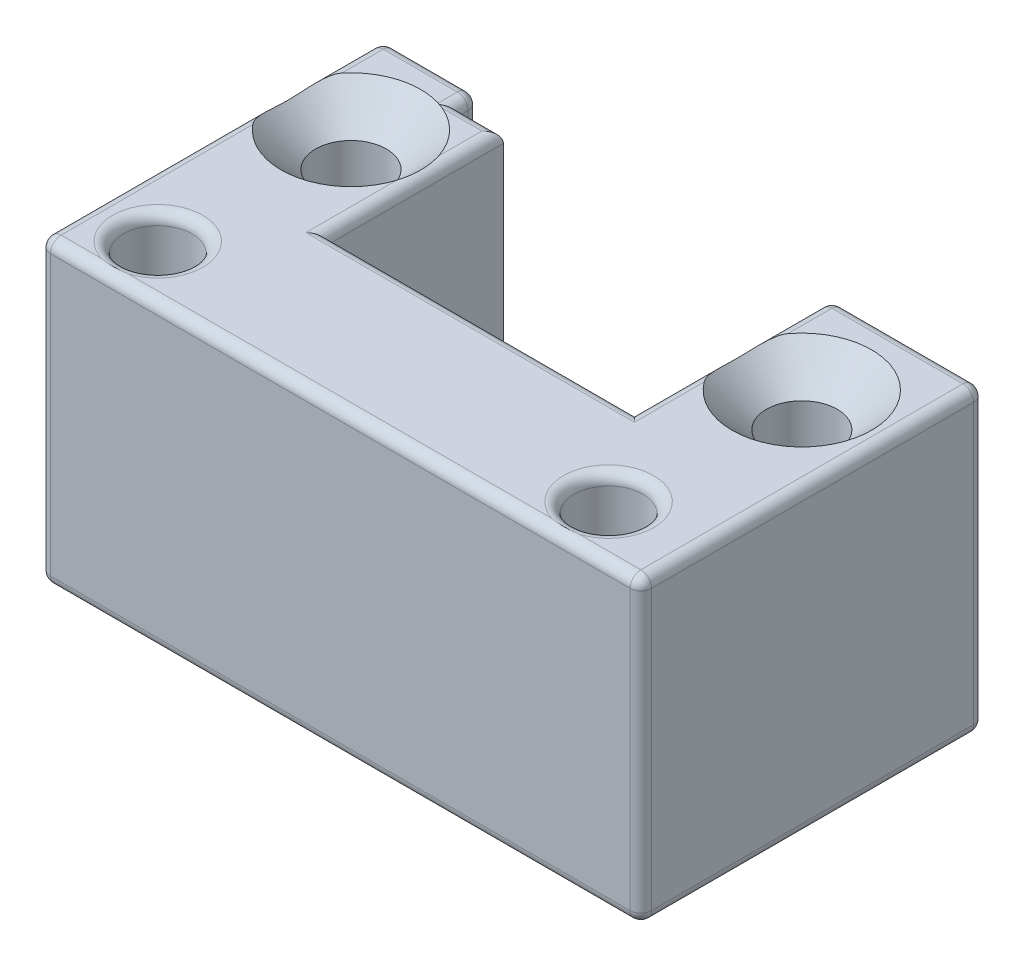
from build123d import *

# Parameters (mm, degrees)
SKETCH1_W                                       = 28
SKETCH1_H                                       = 16
SKETCH1_R                                       = 0.85
SKETCH1_R_2                                     = 1.6
BOSS_EXTRUDE1_DEPTH                             = 4
SKETCH2_R                                       = 1.6
BOSS_EXTRUDE2_DEPTH                             = 10
FILLET1_R                                       = 0.5
CSK_FOR_M5_FLAT_HEAD_MACHINE_SCREW1_D           = 3.3
CSK_FOR_M5_FLAT_HEAD_MACHINE_SCREW1_CSINK_D     = 6.5
CSK_FOR_M5_FLAT_HEAD_MACHINE_SCREW1_CSINK_ANGLE = 90


with BuildPart() as part:
    # Sketch1 → Boss-Extrude1 (new body)
    with BuildSketch(Plane(origin=(0, 0, 0), x_dir=(1, 0, 0), z_dir=(0, 1, 0))):
        with Locations((0, -2)):
            Rectangle(SKETCH1_W, SKETCH1_H)
        with Locations(Location((3.25, 0, 0), (0, 0, 270))):
            Circle(SKETCH1_R, mode=Mode.SUBTRACT)
        with Locations(Location((-3.25, 0, 0), (0, 0, 270))):
            Circle(SKETCH1_R, mode=Mode.SUBTRACT)
        with Locations(Location((-11, -7.5, 0), (0, 0, 270))):
            Circle(SKETCH1_R_2, mode=Mode.SUBTRACT)
        with Locations(Location((10, -7.5, 0), (0, 0, 270))):
            Circle(SKETCH1_R_2, mode=Mode.SUBTRACT)
        with Locations(Location((-11, 1.5, 0), (0, 0, 270))):
            Circle(SKETCH1_R_2, mode=Mode.SUBTRACT)
        with Locations(Location((10, 1.5, 0), (0, 0, 270))):
            Circle(SKETCH1_R_2, mode=Mode.SUBTRACT)
    extrude(amount=BOSS_EXTRUDE1_DEPTH)

    # Sketch2 → Boss-Extrude2 (add)
    with BuildSketch(Plane(origin=(0, 4, 0), x_dir=(1, 0, 0), z_dir=(0, 1, 0))):
        Polygon((-9.546214808, 6), (-9.546214808, 5), (-7.4, 5), (-7.4, -3.2), (6.9, -3.2), (6.9, 6), (14, 6), (14, -10), (-14, -10), (-14, 6), align=None)
        with Locations(Location((-11, -7.5, 0), (0, 0, 270))):
            Circle(SKETCH2_R, mode=Mode.SUBTRACT)
        with Locations(Location((10, -7.5, 0), (0, 0, 270))):
            Circle(SKETCH2_R, mode=Mode.SUBTRACT)
        with Locations(Location((10, 1.5, 0), (0, 0, 270))):
            Circle(SKETCH2_R, mode=Mode.SUBTRACT)
        with Locations(Location((-11, 1.5, 0), (0, 0, 270))):
            Circle(SKETCH2_R, mode=Mode.SUBTRACT)
    extrude(amount=BOSS_EXTRUDE2_DEPTH)

    # Fillet1
    # the kernel refuses this fillet: 0.5 mm, written as the material it takes off along each edge
    with BuildSketch(Plane(origin=(-13.5, 13.5, -5.5), x_dir=(-1, 0, 0), z_dir=(0, 1, 0))) as fillet1_piece_1_section:
        Polygon((0, 0), (FILLET1_R, 0), (FILLET1_R, -FILLET1_R), (0, -FILLET1_R), align=None)
    fillet1_piece_1 = extrude(amount=FILLET1_R, mode=Mode.PRIVATE)
    fillet1_piece_1 = fillet1_piece_1 - Plane(origin=(-13.5, 13.5, -5.5), x_dir=(0.7071067811865477, 0, 0.7071067811865475), z_dir=(0, 1, 0)) * Sphere(FILLET1_R, mode=Mode.PRIVATE)
    add(fillet1_piece_1, mode=Mode.SUBTRACT)
    with BuildSketch(Plane(origin=(-10.046214808, 13.5, -5.5), x_dir=(1, 0, 0), z_dir=(0, 1, 0))) as fillet1_piece_2_section:
        Polygon((0, 0), (FILLET1_R, 0), (FILLET1_R, FILLET1_R), (0, FILLET1_R), align=None)
    fillet1_piece_2 = extrude(amount=FILLET1_R, mode=Mode.PRIVATE)
    fillet1_piece_2 = fillet1_piece_2 - Plane(origin=(-10.046214808, 13.5, -5.5), x_dir=(-0.7071067811865475, 0, 0.7071067811865476), z_dir=(0, 1, 0)) * Sphere(FILLET1_R, mode=Mode.PRIVATE)
    add(fillet1_piece_2, mode=Mode.SUBTRACT)
    with BuildSketch(Plane(origin=(-13.5, 13.5, 9.5), x_dir=(-1, 0, 0), z_dir=(0, 1, 0))) as fillet1_piece_3_section:
        Polygon((0, 0), (FILLET1_R, 0), (FILLET1_R, FILLET1_R), (0, FILLET1_R), align=None)
    fillet1_piece_3 = extrude(amount=FILLET1_R, mode=Mode.PRIVATE)
    fillet1_piece_3 = fillet1_piece_3 - Plane(origin=(-13.5, 13.5, 9.5), x_dir=(0.7071067811865475, 0, -0.7071067811865476), z_dir=(0, 1, 0)) * Sphere(FILLET1_R, mode=Mode.PRIVATE)
    add(fillet1_piece_3, mode=Mode.SUBTRACT)
    with BuildSketch(Plane(origin=(13.5, 13.5, 9.5), x_dir=(0, 1, 0), z_dir=(0, 0, 1))) as fillet1_piece_4_section:
        Polygon((0, 0), (FILLET1_R, 0), (FILLET1_R, -FILLET1_R), (0, -FILLET1_R), align=None)
    fillet1_piece_4 = extrude(amount=FILLET1_R, mode=Mode.PRIVATE)
    fillet1_piece_4 = fillet1_piece_4 - Plane(origin=(13.5, 13.5, 9.5), x_dir=(-0.7071067811865475, -0.7071067811865475, 0), z_dir=(0, 0, 1)) * Sphere(FILLET1_R, mode=Mode.PRIVATE)
    add(fillet1_piece_4, mode=Mode.SUBTRACT)
    with BuildSketch(Plane(origin=(13.5, 13.5, -5.5), x_dir=(0, 0, -1), z_dir=(0, 1, 0))) as fillet1_piece_5_section:
        Polygon((0, 0), (FILLET1_R, 0), (FILLET1_R, -FILLET1_R), (0, -FILLET1_R), align=None)
    fillet1_piece_5 = extrude(amount=FILLET1_R, mode=Mode.PRIVATE)
    fillet1_piece_5 = fillet1_piece_5 - Plane(origin=(13.5, 13.5, -5.5), x_dir=(-0.7071067811865474, 0, 0.7071067811865477), z_dir=(0, 1, 0)) * Sphere(FILLET1_R, mode=Mode.PRIVATE)
    add(fillet1_piece_5, mode=Mode.SUBTRACT)
    with BuildSketch(Plane(origin=(7.4, 13.5, -5.5), x_dir=(-1, 0, 0), z_dir=(0, 1, 0))) as fillet1_piece_6_section:
        Polygon((0, 0), (FILLET1_R, 0), (FILLET1_R, -FILLET1_R), (0, -FILLET1_R), align=None)
    fillet1_piece_6 = extrude(amount=FILLET1_R, mode=Mode.PRIVATE)
    fillet1_piece_6 = fillet1_piece_6 - Plane(origin=(7.4, 13.5, -5.5), x_dir=(0.7071067811865477, 0, 0.7071067811865475), z_dir=(0, 1, 0)) * Sphere(FILLET1_R, mode=Mode.PRIVATE)
    add(fillet1_piece_6, mode=Mode.SUBTRACT)
    with BuildSketch(Plane(origin=(-13.5, 0.5, 9.5), x_dir=(0, -1, 0), z_dir=(0, 0, 1))) as fillet1_piece_7_section:
        Polygon((0, 0), (FILLET1_R, 0), (FILLET1_R, -FILLET1_R), (0, -FILLET1_R), align=None)
    fillet1_piece_7 = extrude(amount=FILLET1_R, mode=Mode.PRIVATE)
    fillet1_piece_7 = fillet1_piece_7 - Plane(origin=(-13.5, 0.5, 9.5), x_dir=(0.7071067811865475, 0.7071067811865475, 0), z_dir=(0, 0, 1)) * Sphere(FILLET1_R, mode=Mode.PRIVATE)
    add(fillet1_piece_7, mode=Mode.SUBTRACT)
    with BuildSketch(Plane(origin=(13.5, 0.5, 9.5), x_dir=(0, -1, 0), z_dir=(0, 0, 1))) as fillet1_piece_8_section:
        Polygon((0, 0), (FILLET1_R, 0), (FILLET1_R, FILLET1_R), (0, FILLET1_R), align=None)
    fillet1_piece_8 = extrude(amount=FILLET1_R, mode=Mode.PRIVATE)
    fillet1_piece_8 = fillet1_piece_8 - Plane(origin=(13.5, 0.5, 9.5), x_dir=(-0.7071067811865475, 0.7071067811865475, 0), z_dir=(0, 0, 1)) * Sphere(FILLET1_R, mode=Mode.PRIVATE)
    add(fillet1_piece_8, mode=Mode.SUBTRACT)
    with BuildSketch(Plane(origin=(-13.5, 0.5, -5.5), x_dir=(-1, 0, 0), z_dir=(0, -1, 0))) as fillet1_piece_9_section:
        Polygon((0, 0), (FILLET1_R, 0), (FILLET1_R, FILLET1_R), (0, FILLET1_R), align=None)
    fillet1_piece_9 = extrude(amount=FILLET1_R, mode=Mode.PRIVATE)
    fillet1_piece_9 = fillet1_piece_9 - Plane(origin=(-13.5, 0.5, -5.5), x_dir=(0.7071067811865477, 0, 0.7071067811865475), z_dir=(0, -1, 0)) * Sphere(FILLET1_R, mode=Mode.PRIVATE)
    add(fillet1_piece_9, mode=Mode.SUBTRACT)
    with BuildSketch(Plane(origin=(13.5, 0.5, -5.5), x_dir=(0, 0, -1), z_dir=(0, -1, 0))) as fillet1_piece_10_section:
        Polygon((0, 0), (FILLET1_R, 0), (FILLET1_R, FILLET1_R), (0, FILLET1_R), align=None)
    fillet1_piece_10 = extrude(amount=FILLET1_R, mode=Mode.PRIVATE)
    fillet1_piece_10 = fillet1_piece_10 - Plane(origin=(13.5, 0.5, -5.5), x_dir=(-0.7071067811865474, 0, 0.7071067811865477), z_dir=(0, -1, 0)) * Sphere(FILLET1_R, mode=Mode.PRIVATE)
    add(fillet1_piece_10, mode=Mode.SUBTRACT)
    with BuildSketch(Plane(origin=(3.25, 0, 0), x_dir=(0, 0, 1), z_dir=(-1, 0, 0))) as fillet1_piece_11:
        with BuildLine():
            CenterArc((0.85 + FILLET1_R, FILLET1_R), FILLET1_R, 180, 90)
            Line((0.85, FILLET1_R), (0.85, 0))
            Line((0.85, 0), (0.85 + FILLET1_R, 0))
        make_face()
    revolve(axis=Axis((3.25, 0, 0), (0, 1, 0)), mode=Mode.SUBTRACT)
    with BuildSketch(Plane(origin=(-3.25, 0, 0), x_dir=(0, 0, 1), z_dir=(-1, 0, 0))) as fillet1_piece_12:
        with BuildLine():
            CenterArc((0.85 + FILLET1_R, FILLET1_R), FILLET1_R, 180, 90)
            Line((0.85, FILLET1_R), (0.85, 0))
            Line((0.85, 0), (0.85 + FILLET1_R, 0))
        make_face()
    revolve(axis=Axis((-3.25, 0, 0), (0, 1, 0)), mode=Mode.SUBTRACT)
    with BuildSketch(Plane(origin=(-11, 0, 7.5), x_dir=(0, 0, 1), z_dir=(-1, 0, 0))) as fillet1_piece_13:
        with BuildLine():
            CenterArc((1.6 + FILLET1_R, FILLET1_R), FILLET1_R, 180, 90)
            Line((1.6, FILLET1_R), (1.6, 0))
            Line((1.6, 0), (1.6 + FILLET1_R, 0))
        make_face()
    revolve(axis=Axis((-11, 0, 7.5), (0, 1, 0)), mode=Mode.SUBTRACT)
    with BuildSketch(Plane(origin=(10, 0, 7.5), x_dir=(0, 0, 1), z_dir=(-1, 0, 0))) as fillet1_piece_14:
        with BuildLine():
            CenterArc((1.6 + FILLET1_R, FILLET1_R), FILLET1_R, 180, 90)
            Line((1.6, FILLET1_R), (1.6, 0))
            Line((1.6, 0), (1.6 + FILLET1_R, 0))
        make_face()
    revolve(axis=Axis((10, 0, 7.5), (0, 1, 0)), mode=Mode.SUBTRACT)
    with BuildSketch(Plane(origin=(-11, 0, -1.5), x_dir=(0, 0, 1), z_dir=(-1, 0, 0))) as fillet1_piece_15:
        with BuildLine():
            CenterArc((1.6 + FILLET1_R, FILLET1_R), FILLET1_R, 180, 90)
            Line((1.6, FILLET1_R), (1.6, 0))
            Line((1.6, 0), (1.6 + FILLET1_R, 0))
        make_face()
    revolve(axis=Axis((-11, 0, -1.5), (0, 1, 0)), mode=Mode.SUBTRACT)
    with BuildSketch(Plane(origin=(10, 0, -1.5), x_dir=(0, 0, 1), z_dir=(-1, 0, 0))) as fillet1_piece_16:
        with BuildLine():
            CenterArc((1.6 + FILLET1_R, FILLET1_R), FILLET1_R, 180, 90)
            Line((1.6, FILLET1_R), (1.6, 0))
            Line((1.6, 0), (1.6 + FILLET1_R, 0))
        make_face()
    revolve(axis=Axis((10, 0, -1.5), (0, 1, 0)), mode=Mode.SUBTRACT)
    with BuildSketch(Plane(origin=(6.9, 4, -6), x_dir=(0, 0, 1), z_dir=(-1, 0, 0))) as fillet1_piece_17:
        with BuildLine():
            CenterArc((FILLET1_R, -FILLET1_R), FILLET1_R, 90, 90)
            Line((0, -FILLET1_R), (0, 0))
            Line((0, 0), (FILLET1_R, 0))
        make_face()
    extrude(amount=16.446214808, mode=Mode.SUBTRACT)
    with BuildSketch(Plane(origin=(-13.5, 14, -6), x_dir=(0, -1, 0), z_dir=(1, 0, 0))) as fillet1_piece_18:
        with BuildLine():
            CenterArc((FILLET1_R, -FILLET1_R), FILLET1_R, 90, 90)
            Line((0, -FILLET1_R), (0, 0))
            Line((0, 0), (FILLET1_R, 0))
        make_face()
    extrude(amount=3.453785192, mode=Mode.SUBTRACT)
    with BuildSketch(Plane(origin=(-14, 14, 9.5), x_dir=(1, 0, 0), z_dir=(0, 0, -1)), Plane(origin=(-14, 0, -5.5), x_dir=(1, 0, 0), z_dir=(0, 0, 1)), Plane(origin=(14, 0, 9.5), x_dir=(-1, 0, 0), z_dir=(0, 0, -1))) as fillet1_piece_19:
        with BuildLine():
            CenterArc((FILLET1_R, FILLET1_R), FILLET1_R, 180, 90)
            Line((0, FILLET1_R), (0, 0))
            Line((0, 0), (FILLET1_R, 0))
        make_face()
    extrude(amount=15, mode=Mode.SUBTRACT)
    with BuildSketch(Plane(origin=(13.5, 14, 10), x_dir=(0, -1, 0), z_dir=(-1, 0, 0)), Plane(origin=(-13.5, 0, 10), x_dir=(0, 1, 0), z_dir=(1, 0, 0))) as fillet1_piece_20:
        with BuildLine():
            CenterArc((FILLET1_R, -FILLET1_R), FILLET1_R, 90, 90)
            Line((0, -FILLET1_R), (0, 0))
            Line((0, 0), (FILLET1_R, 0))
        make_face()
    extrude(amount=27, mode=Mode.SUBTRACT)
    with BuildSketch(Plane(origin=(14, 14, -5.5), x_dir=(0, -1, 0), z_dir=(0, 0, 1))) as fillet1_piece_21:
        with BuildLine():
            CenterArc((FILLET1_R, -FILLET1_R), FILLET1_R, 90, 90)
            Line((0, -FILLET1_R), (0, 0))
            Line((0, 0), (FILLET1_R, 0))
        make_face()
    extrude(amount=15, mode=Mode.SUBTRACT)
    with BuildSketch(Plane(origin=(7.4, 14, -6), x_dir=(0, -1, 0), z_dir=(1, 0, 0))) as fillet1_piece_22:
        with BuildLine():
            CenterArc((FILLET1_R, -FILLET1_R), FILLET1_R, 90, 90)
            Line((0, -FILLET1_R), (0, 0))
            Line((0, 0), (FILLET1_R, 0))
        make_face()
    extrude(amount=6.1, mode=Mode.SUBTRACT)
    with BuildSketch(Plane(origin=(6.9, 14, 3.2), x_dir=(0, -1, 0), z_dir=(0, 0, -1))) as fillet1_piece_23:
        with BuildLine():
            CenterArc((FILLET1_R, -FILLET1_R), FILLET1_R, 90, 90)
            Line((0, -FILLET1_R), (0, 0))
            Line((0, 0), (FILLET1_R, 0))
        make_face()
    extrude(amount=8.7, mode=Mode.SUBTRACT)
    with BuildSketch(Plane(origin=(-7.4, 14, 3.2), x_dir=(0, -1, 0), z_dir=(1, 0, 0))) as fillet1_piece_24:
        with BuildLine():
            CenterArc((FILLET1_R, -FILLET1_R), FILLET1_R, 90, 90)
            Line((0, -FILLET1_R), (0, 0))
            Line((0, 0), (FILLET1_R, 0))
        make_face()
    extrude(amount=14.3, mode=Mode.SUBTRACT)
    with BuildSketch(Plane(origin=(-7.4, 14, -6.25), x_dir=(0, -1, 0), z_dir=(0, 0, 1))) as fillet1_piece_25:
        with BuildLine():
            CenterArc((FILLET1_R, -FILLET1_R), FILLET1_R, 90, 90)
            Line((0, -FILLET1_R), (0, 0))
            Line((0, 0), (FILLET1_R, 0))
        make_face()
    extrude(amount=9.45, mode=Mode.SUBTRACT)
    with BuildSketch(Plane(origin=(-9.546214808, 14, -5), x_dir=(0, -1, 0), z_dir=(1, 0, 0))) as fillet1_piece_26:
        with BuildLine():
            CenterArc((FILLET1_R, -FILLET1_R), FILLET1_R, 90, 90)
            Line((0, -FILLET1_R), (0, 0))
            Line((0, 0), (FILLET1_R, 0))
        make_face()
    extrude(amount=3.396214808, mode=Mode.SUBTRACT)
    with BuildSketch(Plane(origin=(-9.546214808, 14, -5.5), x_dir=(0, -1, 0), z_dir=(0, 0, 1))) as fillet1_piece_27:
        with BuildLine():
            CenterArc((FILLET1_R, -FILLET1_R), FILLET1_R, 90, 90)
            Line((0, -FILLET1_R), (0, 0))
            Line((0, 0), (FILLET1_R, 0))
        make_face()
    extrude(amount=0.5, mode=Mode.SUBTRACT)
    with BuildSketch(Plane(origin=(-9.546214808, 4, -6), x_dir=(0, 0, 1), z_dir=(0, 1, 0))) as fillet1_piece_28:
        with BuildLine():
            CenterArc((FILLET1_R, -FILLET1_R), FILLET1_R, 90, 90)
            Line((0, -FILLET1_R), (0, 0))
            Line((0, 0), (FILLET1_R, 0))
        make_face()
    extrude(amount=9.5, mode=Mode.SUBTRACT)
    with BuildSketch(Plane(origin=(6.9, 4, -6), x_dir=(0, 0, 1), z_dir=(0, 1, 0))) as fillet1_piece_29:
        with BuildLine():
            CenterArc((FILLET1_R, FILLET1_R), FILLET1_R, 180, 90)
            Line((0, FILLET1_R), (0, 0))
            Line((0, 0), (FILLET1_R, 0))
        make_face()
    extrude(amount=9.5, mode=Mode.SUBTRACT)
    with BuildSketch(Plane(origin=(-11, 14, 7.5), x_dir=(0, 0, 1), z_dir=(-1, 0, 0))) as fillet1_piece_30:
        with BuildLine():
            CenterArc((1.6 + FILLET1_R, -FILLET1_R), FILLET1_R, 90, 90)
            Line((1.6 + FILLET1_R, 0), (1.6, 0))
            Line((1.6, 0), (1.6, -FILLET1_R))
        make_face()
    revolve(axis=Axis((-11, 14, 7.5), (0, 1, 0)), mode=Mode.SUBTRACT)
    with BuildSketch(Plane(origin=(10, 14, 7.5), x_dir=(0, 0, 1), z_dir=(-1, 0, 0))) as fillet1_piece_31:
        with BuildLine():
            CenterArc((1.6 + FILLET1_R, -FILLET1_R), FILLET1_R, 90, 90)
            Line((1.6 + FILLET1_R, 0), (1.6, 0))
            Line((1.6, 0), (1.6, -FILLET1_R))
        make_face()
    revolve(axis=Axis((10, 14, 7.5), (0, 1, 0)), mode=Mode.SUBTRACT)
    with BuildSketch(Plane(origin=(10, 14, -1.5), x_dir=(0, 0, 1), z_dir=(-1, 0, 0))) as fillet1_piece_32:
        with BuildLine():
            CenterArc((1.6 + FILLET1_R, -FILLET1_R), FILLET1_R, 90, 90)
            Line((1.6 + FILLET1_R, 0), (1.6, 0))
            Line((1.6, 0), (1.6, -FILLET1_R))
        make_face()
    revolve(axis=Axis((10, 14, -1.5), (0, 1, 0)), mode=Mode.SUBTRACT)
    with BuildSketch(Plane(origin=(-11, 14, -1.5), x_dir=(0, 0, 1), z_dir=(-1, 0, 0))) as fillet1_piece_33:
        with BuildLine():
            CenterArc((1.6 + FILLET1_R, -FILLET1_R), FILLET1_R, 90, 90)
            Line((1.6 + FILLET1_R, 0), (1.6, 0))
            Line((1.6, 0), (1.6, -FILLET1_R))
        make_face()
    revolve(axis=Axis((-11, 14, -1.5), (0, 1, 0)), mode=Mode.SUBTRACT)
    with BuildSketch(Plane(origin=(13.5, 0, -6), x_dir=(0, 0, 1), z_dir=(-1, 0, 0))) as fillet1_piece_34:
        with BuildLine():
            CenterArc((FILLET1_R, FILLET1_R), FILLET1_R, 180, 90)
            Line((0, FILLET1_R), (0, 0))
            Line((0, 0), (FILLET1_R, 0))
        make_face()
    extrude(amount=27, mode=Mode.SUBTRACT)
    with BuildSketch(Plane(origin=(14, 0.5, 10), x_dir=(-1, 0, 0), z_dir=(0, 1, 0)), Plane(origin=(-14, 13.5, 10), x_dir=(1, 0, 0), z_dir=(0, -1, 0))) as fillet1_piece_35:
        with BuildLine():
            CenterArc((FILLET1_R, -FILLET1_R), FILLET1_R, 90, 90)
            Line((0, -FILLET1_R), (0, 0))
            Line((0, 0), (FILLET1_R, 0))
        make_face()
    extrude(amount=13, mode=Mode.SUBTRACT)
    with BuildSketch(Plane(origin=(-14, 13.5, -6), x_dir=(1, 0, 0), z_dir=(0, -1, 0)), Plane(origin=(14, 0.5, -6), x_dir=(-1, 0, 0), z_dir=(0, 1, 0))) as fillet1_piece_36:
        with BuildLine():
            CenterArc((FILLET1_R, FILLET1_R), FILLET1_R, 180, 90)
            Line((0, FILLET1_R), (0, 0))
            Line((0, 0), (FILLET1_R, 0))
        make_face()
    extrude(amount=13, mode=Mode.SUBTRACT)
    with BuildSketch(Plane(origin=(8.15, 4, -6), x_dir=(0, 0, 1), z_dir=(-1, 0, 0))) as fillet1_piece_37a_section:
        with BuildLine():
            CenterArc((FILLET1_R, -FILLET1_R), FILLET1_R, 90, 90)
            Line((0, -FILLET1_R), (0, 0))
            Line((0, 0), (FILLET1_R, 0))
        make_face()
    fillet1_piece_37a = extrude(amount=17.696214808, mode=Mode.PRIVATE)
    fillet1_piece_37a = split(fillet1_piece_37a, bisect_by=Plane(origin=(6.9, 3.886802443, -5.886802443), z_dir=(1, 0, 0)), keep=Keep.TOP, mode=Mode.PRIVATE)
    with BuildSketch(Plane(origin=(6.9, 2.75, -6), x_dir=(0, 0, 1), z_dir=(0, 1, 0))) as fillet1_piece_37b_section:
        with BuildLine():
            CenterArc((FILLET1_R, FILLET1_R), FILLET1_R, 180, 90)
            Line((0, FILLET1_R), (0, 0))
            Line((0, 0), (FILLET1_R, 0))
        make_face()
    fillet1_piece_37b = extrude(amount=10.75, mode=Mode.PRIVATE)
    fillet1_piece_37b = split(fillet1_piece_37b, bisect_by=Plane(origin=(7.013197557, 4, -5.886802443), z_dir=(0, -1, 0)), keep=Keep.TOP, mode=Mode.PRIVATE)
    fillet1_piece_37 = fillet1_piece_37a & fillet1_piece_37b
    add(fillet1_piece_37, mode=Mode.SUBTRACT)
    with BuildSketch(Plane(origin=(6.9, 4, -6), x_dir=(0, 0, 1), z_dir=(-1, 0, 0))) as fillet1_piece_38a_section:
        with BuildLine():
            CenterArc((FILLET1_R, -FILLET1_R), FILLET1_R, 90, 90)
            Line((0, -FILLET1_R), (0, 0))
            Line((0, 0), (FILLET1_R, 0))
        make_face()
    fillet1_piece_38a = extrude(amount=17.696214808, mode=Mode.PRIVATE)
    fillet1_piece_38a = split(fillet1_piece_38a, bisect_by=Plane(origin=(-9.546214808, 3.886802443, -5.886802443), z_dir=(-1, 0, 0)), keep=Keep.TOP, mode=Mode.PRIVATE)
    with BuildSketch(Plane(origin=(-9.546214808, 2.75, -6), x_dir=(0, 0, 1), z_dir=(0, 1, 0))) as fillet1_piece_38b_section:
        with BuildLine():
            CenterArc((FILLET1_R, -FILLET1_R), FILLET1_R, 90, 90)
            Line((0, -FILLET1_R), (0, 0))
            Line((0, 0), (FILLET1_R, 0))
        make_face()
    fillet1_piece_38b = extrude(amount=10.75, mode=Mode.PRIVATE)
    fillet1_piece_38b = split(fillet1_piece_38b, bisect_by=Plane(origin=(-9.659412365, 4, -5.886802443), z_dir=(0, -1, 0)), keep=Keep.TOP, mode=Mode.PRIVATE)
    fillet1_piece_38 = fillet1_piece_38a & fillet1_piece_38b
    add(fillet1_piece_38, mode=Mode.SUBTRACT)
    with BuildSketch(Plane(origin=(-7.4, 14, 3.2), x_dir=(0, -1, 0), z_dir=(1, 0, 0))) as fillet1_piece_39a_section:
        with BuildLine():
            CenterArc((FILLET1_R, -FILLET1_R), FILLET1_R, 90, 90)
            Line((0, -FILLET1_R), (0, 0))
            Line((0, 0), (FILLET1_R, 0))
        make_face()
    fillet1_piece_39a = extrude(amount=15.55, mode=Mode.PRIVATE)
    fillet1_piece_39a = split(fillet1_piece_39a, bisect_by=Plane(origin=(6.9, 13.886802443, 3.313197557), z_dir=(1, 0, 0)), keep=Keep.TOP, mode=Mode.PRIVATE)
    with BuildSketch(Plane(origin=(6.9, 14, 4.45), x_dir=(0, -1, 0), z_dir=(0, 0, -1))) as fillet1_piece_39b_section:
        with BuildLine():
            CenterArc((FILLET1_R, -FILLET1_R), FILLET1_R, 90, 90)
            Line((0, -FILLET1_R), (0, 0))
            Line((0, 0), (FILLET1_R, 0))
        make_face()
    fillet1_piece_39b = extrude(amount=9.95, mode=Mode.PRIVATE)
    fillet1_piece_39b = split(fillet1_piece_39b, bisect_by=Plane(origin=(7.013197557, 13.886802443, 3.2), z_dir=(0, 0, 1)), keep=Keep.TOP, mode=Mode.PRIVATE)
    fillet1_piece_39 = fillet1_piece_39a & fillet1_piece_39b
    add(fillet1_piece_39, mode=Mode.SUBTRACT)
    with BuildSketch(Plane(origin=(-7.4, 14, -6.25), x_dir=(0, -1, 0), z_dir=(0, 0, 1))) as fillet1_piece_40a_section:
        with BuildLine():
            CenterArc((FILLET1_R, -FILLET1_R), FILLET1_R, 90, 90)
            Line((0, -FILLET1_R), (0, 0))
            Line((0, 0), (FILLET1_R, 0))
        make_face()
    fillet1_piece_40a = extrude(amount=10.7, mode=Mode.PRIVATE)
    fillet1_piece_40a = split(fillet1_piece_40a, bisect_by=Plane(origin=(-7.513197557, 13.886802443, 3.2), z_dir=(0, 0, 1)), keep=Keep.TOP, mode=Mode.PRIVATE)
    with BuildSketch(Plane(origin=(-8.65, 14, 3.2), x_dir=(0, -1, 0), z_dir=(1, 0, 0))) as fillet1_piece_40b_section:
        with BuildLine():
            CenterArc((FILLET1_R, -FILLET1_R), FILLET1_R, 90, 90)
            Line((0, -FILLET1_R), (0, 0))
            Line((0, 0), (FILLET1_R, 0))
        make_face()
    fillet1_piece_40b = extrude(amount=15.55, mode=Mode.PRIVATE)
    fillet1_piece_40b = split(fillet1_piece_40b, bisect_by=Plane(origin=(-7.4, 13.886802443, 3.313197557), z_dir=(-1, 0, 0)), keep=Keep.TOP, mode=Mode.PRIVATE)
    fillet1_piece_40 = fillet1_piece_40a & fillet1_piece_40b
    add(fillet1_piece_40, mode=Mode.SUBTRACT)
    with BuildSketch(Plane(origin=(-9.546214808, 14, -5.5), x_dir=(0, -1, 0), z_dir=(0, 0, 1))) as fillet1_piece_41a_section:
        with BuildLine():
            CenterArc((FILLET1_R, -FILLET1_R), FILLET1_R, 90, 90)
            Line((0, -FILLET1_R), (0, 0))
            Line((0, 0), (FILLET1_R, 0))
        make_face()
    fillet1_piece_41a = extrude(amount=1.75, mode=Mode.PRIVATE)
    fillet1_piece_41a = split(fillet1_piece_41a, bisect_by=Plane(origin=(-9.659412365, 13.886802443, -5), z_dir=(0, 0, 1)), keep=Keep.TOP, mode=Mode.PRIVATE)
    with BuildSketch(Plane(origin=(-10.796214808, 14, -5), x_dir=(0, -1, 0), z_dir=(1, 0, 0))) as fillet1_piece_41b_section:
        with BuildLine():
            CenterArc((FILLET1_R, -FILLET1_R), FILLET1_R, 90, 90)
            Line((0, -FILLET1_R), (0, 0))
            Line((0, 0), (FILLET1_R, 0))
        make_face()
    fillet1_piece_41b = extrude(amount=4.646214808, mode=Mode.PRIVATE)
    fillet1_piece_41b = split(fillet1_piece_41b, bisect_by=Plane(origin=(-9.546214808, 13.886802443, -4.886802443), z_dir=(-1, 0, 0)), keep=Keep.TOP, mode=Mode.PRIVATE)
    fillet1_piece_41 = fillet1_piece_41a & fillet1_piece_41b
    add(fillet1_piece_41, mode=Mode.SUBTRACT)

    # CSK for M5 Flat Head Machine Screw1 (through all)
    with Locations(Plane(origin=(10, 14, -1.5), x_dir=(0, 0, 1), z_dir=(0, 1, 0))):
        with Locations((0, 0), (0, -21)):
            CounterSinkHole(CSK_FOR_M5_FLAT_HEAD_MACHINE_SCREW1_D / 2, CSK_FOR_M5_FLAT_HEAD_MACHINE_SCREW1_CSINK_D / 2, counter_sink_angle=CSK_FOR_M5_FLAT_HEAD_MACHINE_SCREW1_CSINK_ANGLE)


solid = part.part
